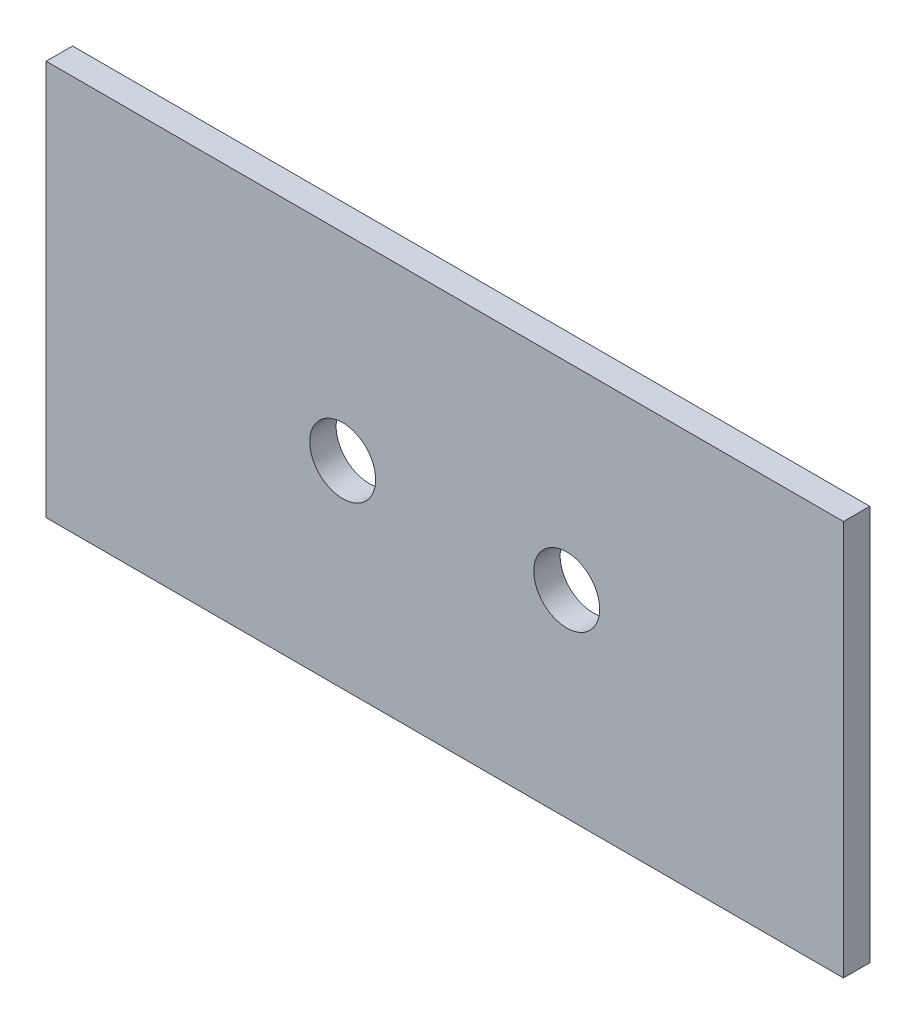
from build123d import *

# Parameters (mm, degrees)
SKETCH1_W           = 121
SKETCH1_H           = 60
SKETCH1_R           = 5
BOSS_EXTRUDE1_DEPTH = 4


with BuildPart() as part:
    # Sketch1 → Boss-Extrude1 (new body)
    with BuildSketch(Plane.XY):
        with Locations((-18.5, 10)):
            Rectangle(SKETCH1_W, SKETCH1_H)
        with Locations((-34, 10)):
            Circle(SKETCH1_R, mode=Mode.SUBTRACT)
        with Locations((0, 10)):
            Circle(SKETCH1_R, mode=Mode.SUBTRACT)
    extrude(amount=BOSS_EXTRUDE1_DEPTH)


solid = part.part
